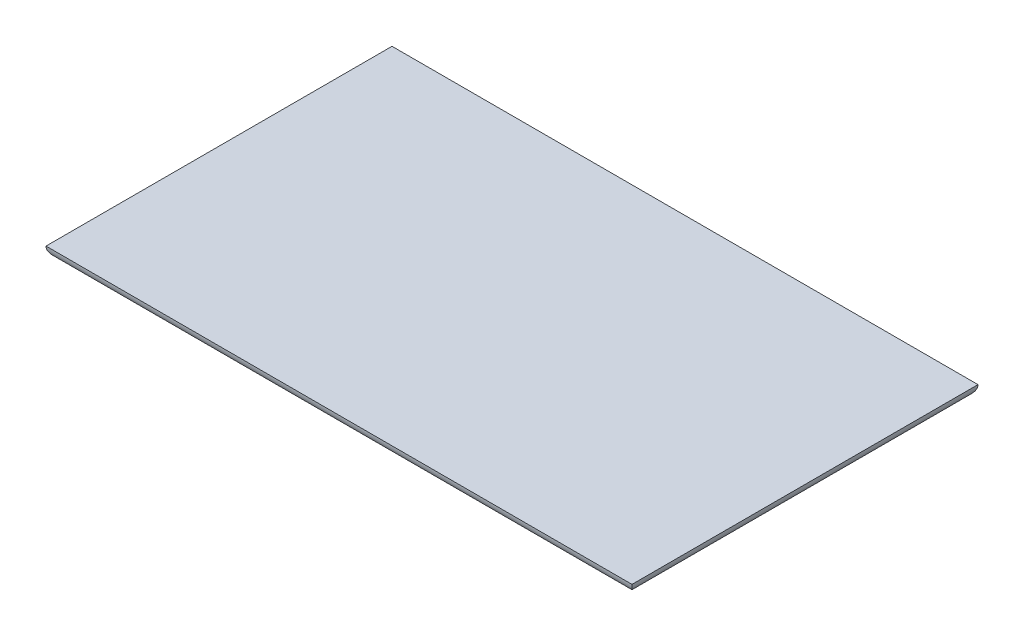
from build123d import *

# Parameters (mm, degrees)
SKETCH1_W           = 104.999999998
SKETCH1_H           = 61.999999997
SKETCH1_W_2         = 102
SKETCH1_H_2         = 59
BOSS_EXTRUDE1_DEPTH = 2
SKETCH1_2_W         = 102
SKETCH1_2_H         = 59
BOSS_EXTRUDE2_DEPTH = 2
FILLET1_R           = 2


with BuildPart() as part:
    # Sketch1 → Boss-Extrude1 (new body)
    with BuildSketch(Plane(origin=(0, 0, 0), x_dir=(1, 0, 0), z_dir=(0, 1, 0))):
        with Locations((3.062796012, -2.779331445)):
            Rectangle(SKETCH1_W, SKETCH1_H)
        with Locations((3.062796013, -2.779331447)):
            Rectangle(SKETCH1_W_2, SKETCH1_H_2, mode=Mode.SUBTRACT)
    extrude(amount=BOSS_EXTRUDE1_DEPTH)

    # Sketch1<2> → Boss-Extrude2 (add)
    with BuildSketch(Plane(origin=(0, 0, 0), x_dir=(1, 0, 0), z_dir=(0, 1, 0))):
        with Locations((3.062796013, -2.779331447)):
            Rectangle(SKETCH1_2_W, SKETCH1_2_H)
    extrude(amount=BOSS_EXTRUDE2_DEPTH)

    # Fillet1
    fillet1_edges = [part.edges().sort_by_distance(p)[0] for p in [
        (3.062796012, 0, 33.779331444),
        (55.562796011, 0, 2.779331445),
        (3.062796012, 0, -28.220668553),
        (-49.437203987, 0, 2.779331445),
    ]]
    fillet(fillet1_edges, radius=FILLET1_R - 0.0001)  # a hair under: the kernel refuses the full size


solid = part.part
